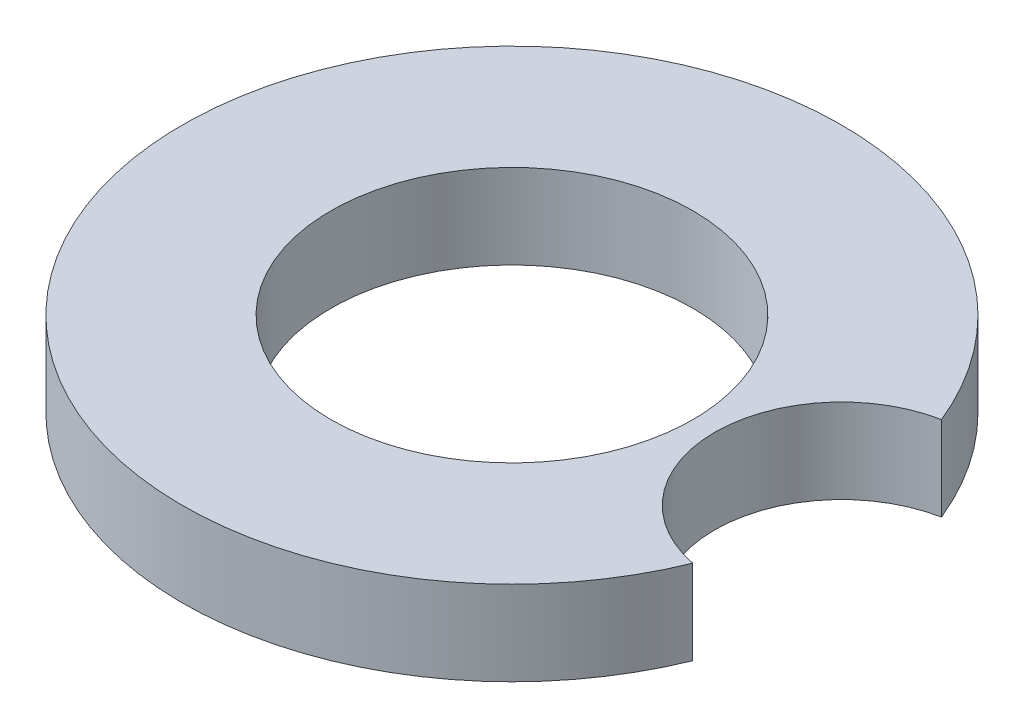
from build123d import *

# Parameters (mm, degrees)
SKETCH1_R           = 49.53
BOSS_EXTRUDE1_DEPTH = 12.7
SKETCH1_10_R        = 27.199999956
CUT_EXTRUDE2_DEPTH  = 72.188003203
SKETCH2_R           = 19.05
CUT_EXTRUDE3_DEPTH  = 72.188003203


with BuildPart() as part:
    # Sketch1 → Boss-Extrude1 (new body)
    with BuildSketch(Plane(origin=(0, 0, 0), x_dir=(1, 0, 0), z_dir=(0, 1, 0))):
        Circle(SKETCH1_R)
    extrude(amount=BOSS_EXTRUDE1_DEPTH)

    # Sketch1<10> → Cut-Extrude2 (cut, through all)
    with BuildSketch(Plane(origin=(0, 0, 0), x_dir=(1, 0, 0), z_dir=(0, 1, 0))):
        Circle(SKETCH1_10_R)
    extrude(amount=CUT_EXTRUDE2_DEPTH, mode=Mode.SUBTRACT)

    # Sketch2 → Cut-Extrude3 (cut, through all)
    with BuildSketch(Plane(origin=(0, 12.7, 0), x_dir=(1, 0, 0), z_dir=(0, 1, 0))):
        with Locations((49.53, 0)):
            Circle(SKETCH2_R)
    extrude(amount=-CUT_EXTRUDE3_DEPTH, mode=Mode.SUBTRACT)


solid = part.part
